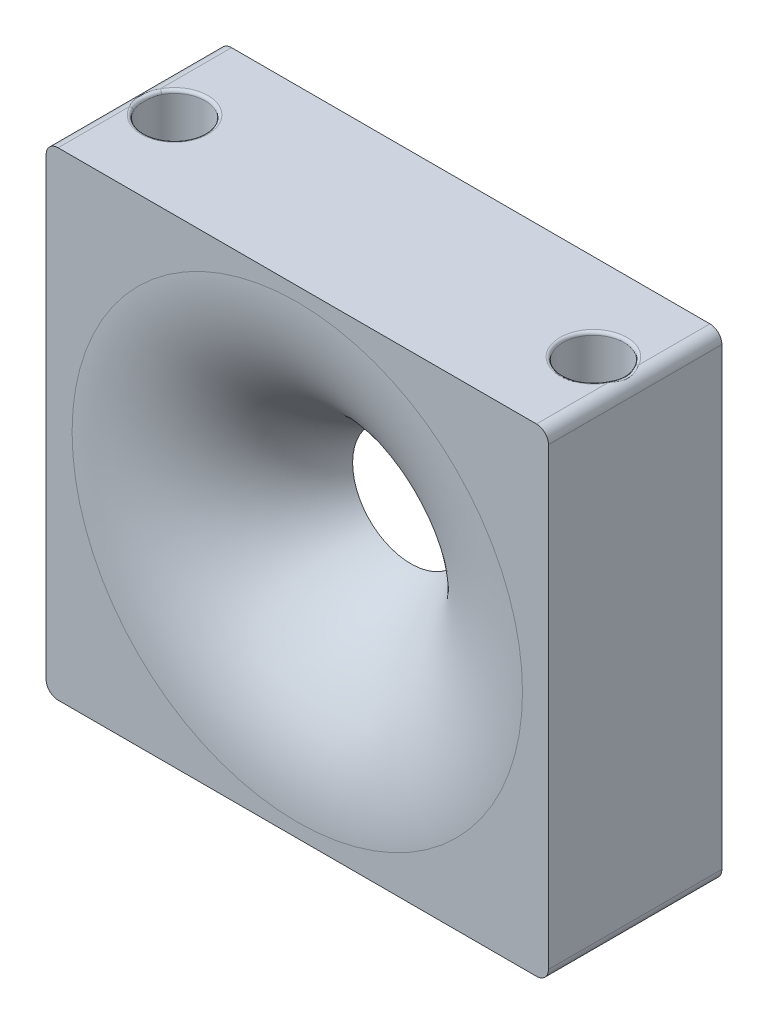
from build123d import *

# Parameters (mm, degrees)
SKETCH1_W                    = 80
SKETCH1_H                    = 84
SKETCH1_R                    = 9.75
F_29_MM_EXTRUDE_DEPTH        = 29
SKETCH2_R                    = 28.5
F_7_MM_CUT_DEPTH             = 10
F_30R_FUNNEL_SLOPE_R         = 30
SKETCH3_R                    = 5.1
F_36_MM_CUT_SCREW_HEAD_DEPTH = 36
SKETCH5_R                    = 3.1
F_7_8MM_BORE_DEPTH           = 95.89467846
F_3R_PIG_HOLE_R              = 3
F_2R_CORNERS_R               = 2
F_0_5R_BOLTS_R               = 0.5


with BuildPart() as part:
    # Sketch1 → 29 mm extrude (new body)
    with BuildSketch(Plane(origin=(0, 0, 0), x_dir=(0, 1, 0), z_dir=(0, 0, 1))):
        Rectangle(SKETCH1_W, SKETCH1_H)
        with Locations(Location((0, 0, 0), (0, 0, 90))):
            Circle(SKETCH1_R, mode=Mode.SUBTRACT)
    extrude(amount=F_29_MM_EXTRUDE_DEPTH)

    # Sketch2 → 7 mm cut (cut)
    with BuildSketch(Plane(origin=(0, 0, 0), x_dir=(1, 0, 0), z_dir=(0, 0, -1))):
        with Locations(Location((0, 0, 0), (0, 0, 180))):
            Circle(SKETCH2_R)
    extrude(amount=-F_7_MM_CUT_DEPTH, mode=Mode.SUBTRACT)

    # 30R funnel slope
    # the kernel refuses this fillet: 30 mm, written as the material it takes off along each edge
    with BuildSketch(Plane(origin=(0, 0, 29), x_dir=(-1, 0, 0), z_dir=(0, 1, 0))) as f_30r_funnel_slope_piece_1:
        with BuildLine():
            CenterArc((37.660571474, -30), F_30R_FUNNEL_SLOPE_R, 90, 68.489811733)
            Line((9.75, -19), (9.191788571, -18.78))
            ThreePointArc((9.191788571, -18.78), (9.15, -9.5), (9.15, 0))
            Line((9.15, 0), (9.75, 0.6))
            Line((9.75, 0.6), (37.660571474, 0.6))
            Line((37.660571474, 0.6), (37.660571474, 0))
        make_face()
    revolve(axis=Axis((0, 0, 29), (0, 0, 1)), mode=Mode.SUBTRACT)

    # Sketch3 → 36 mm cut screw head (cut)
    with BuildSketch(Plane(origin=(0, 40, 0), x_dir=(-1, 0, 0), z_dir=(0, 1, 0))):
        with Locations((-35.025, 14.5)):
            Circle(SKETCH3_R)
        with Locations((35.025, 14.5)):
            Circle(SKETCH3_R)
    extrude(amount=-F_36_MM_CUT_SCREW_HEAD_DEPTH, mode=Mode.SUBTRACT)

    # Sketch5 → 7.8mm bore (cut, through all)
    with BuildSketch(Plane(origin=(0, 40, 0), x_dir=(-1, 0, 0), z_dir=(0, 1, 0))):
        with Locations((-35.025, 14.5)):
            Circle(SKETCH5_R)
    f_7_8mm_bore = extrude(amount=-F_7_8MM_BORE_DEPTH, mode=Mode.SUBTRACT)

    # 3R pig hole
    f_3r_pig_hole_edges = [part.edges().sort_by_distance(p)[0] for p in [
        (28.5, 0, 10),
    ]]
    fillet(f_3r_pig_hole_edges, radius=F_3R_PIG_HOLE_R)

    # 2R corners
    # the kernel refuses this fillet: 2 mm, written as the material it takes off along each edge
    with BuildSketch(Plane(origin=(42, 40, -5), x_dir=(0, -1, 0), z_dir=(0, 0, 1)), Plane(origin=(-42, 40, -5), x_dir=(1, 0, 0), z_dir=(0, 0, 1))) as f_2r_corners_piece_1:
        with BuildLine():
            CenterArc((F_2R_CORNERS_R, -F_2R_CORNERS_R), F_2R_CORNERS_R, 90, 90)
            Line((0, -F_2R_CORNERS_R), (0, 0))
            Line((0, 0), (F_2R_CORNERS_R, 0))
        make_face()
    extrude(amount=39, mode=Mode.SUBTRACT)
    with BuildSketch(Plane(origin=(42, -40, -5), x_dir=(0, 1, 0), z_dir=(0, 0, 1)), Plane(origin=(-42, -40, -5), x_dir=(1, 0, 0), z_dir=(0, 0, 1))) as f_2r_corners_piece_2:
        with BuildLine():
            CenterArc((F_2R_CORNERS_R, F_2R_CORNERS_R), F_2R_CORNERS_R, 180, 90)
            Line((0, F_2R_CORNERS_R), (0, 0))
            Line((0, 0), (F_2R_CORNERS_R, 0))
        make_face()
    extrude(amount=39, mode=Mode.SUBTRACT)

    # 0.5R bolts
    f_0_5r_bolts_edges = [part.edges().sort_by_distance(p)[0] for p in [
        (-29.925, 40, 14.5),
        (34.46042051, 40, 19.568653667),
        (-40.093653599, 39.997806015, 15.064580313),
        (40.125, 39.996089928, 14.5),
    ]]
    fillet(f_0_5r_bolts_edges, radius=F_0_5R_BOLTS_R)

    # Mirror1: 7.8mm bore across plane
    add(f_7_8mm_bore.mirror(Plane(origin=(0, 0, 0), x_dir=(0, 0, 1), z_dir=(1, 0, 0))), mode=Mode.SUBTRACT)


solid = part.part
